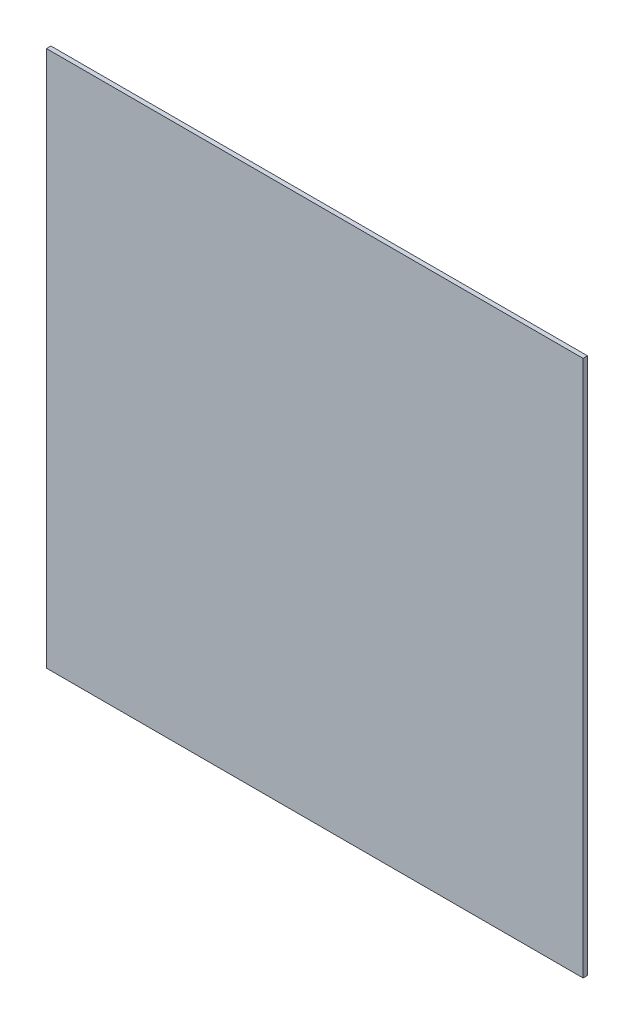
from build123d import *

# Parameters (mm, degrees)
SKETCH1_W           = 400
SKETCH1_H           = 400
BOSS_EXTRUDE1_DEPTH = 3.3


with BuildPart() as part:
    # Sketch1 → Boss-Extrude1 (new body)
    with BuildSketch(Plane.XY):
        with Locations((-27, 196.7)):
            Rectangle(SKETCH1_W, SKETCH1_H)
    extrude(amount=BOSS_EXTRUDE1_DEPTH)


solid = part.part
